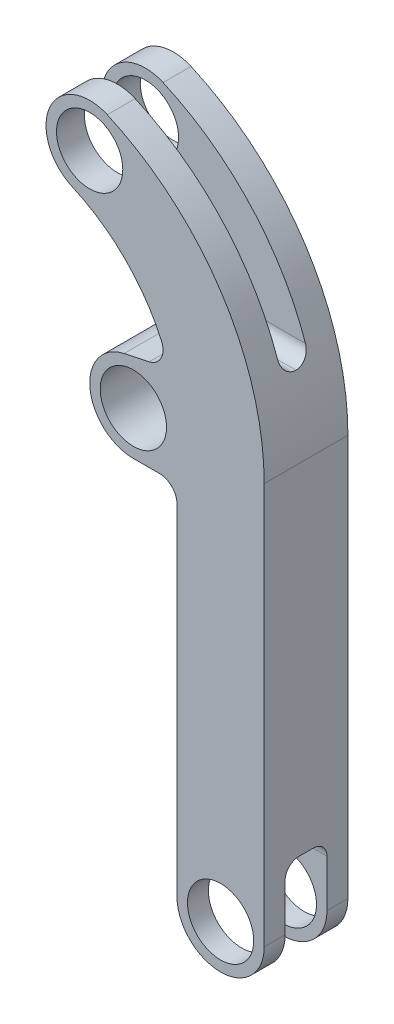
from build123d import *

# Parameters (mm, degrees)
CROQUIS2_R                 = 12.5
CROQUIS2_R_2               = 9.5
SALIENTE_EXTRUIR1_DEPTH    = 24
CORTAR_EXTRUIR3_DEPTH      = 191.437747955
CORTAR_EXTRUIR3_DEPTH_BACK = 191.437747955
CROQUIS5_W                 = 8
CROQUIS5_H                 = 49.434743854
CORTAR_EXTRUIR4_DEPTH      = 191.437747955
CORTAR_EXTRUIR4_DEPTH_BACK = 191.437747955
CROQUIS6_W                 = 12
CROQUIS6_H                 = 30
CORTAR_EXTRUIR5_DEPTH      = 159.265939688
CORTAR_EXTRUIR5_DEPTH_BACK = 159.265939688
CROQUIS7_W                 = 14.533349016
CROQUIS7_H                 = 8
REDONDEO1_R                = 4


with BuildPart() as part:
    # Croquis2 → Saliente-Extruir1 (new body)
    # profile 1 of 4: a face of its own
    with BuildSketch(Plane.XY):
        with Locations((-37.533349016, 172.653405471)):
            Circle(CROQUIS2_R)
        with Locations((-37.533349016, 172.653405471)):
            Circle(CROQUIS2_R_2, mode=Mode.SUBTRACT)
    # profile 2 of 4: a face of its own
    with BuildSketch(Plane.XY):
        with BuildLine():
            Line((-12.5, 58.855421297), (-12.5, 0))
            ThreePointArc((-12.5, 0), (0, 12.5), (12.5, 0))
            Line((12.5, 0), (12.5, 115))
            ThreePointArc((12.5, 115), (0.265693313, 156.217157525), (-32.475079629, 184.08423706))
            ThreePointArc((-32.475079629, 184.08423706), (-27.057701844, 179.473289366), (-25.033349016, 172.653405471))
            ThreePointArc((-25.033349016, 172.653405471), (-30.713465121, 162.1777583), (-42.591618403, 161.222573883))
            ThreePointArc((-42.591618403, 161.222573883), (-27.406897086, 150.843693068), (-16.941222141, 135.718661617))
            ThreePointArc((-16.941222141, 135.718661617), (-17.037727548, 131.417260647), (-20.439743892, 128.783319041))
            Line((-20.439743892, 128.783319041), (-27.655370554, 127.214704549))
            ThreePointArc((-27.655370554, 127.214704549), (-17.155961879, 124.732474812), (-12.5, 115))
            ThreePointArc((-12.5, 115), (-16.161165235, 106.161165235), (-25, 102.5))
            Line((-25, 102.5), (-17.5, 102.5))
            ThreePointArc((-17.5, 102.5), (-13.964466094, 101.035533906), (-12.5, 97.5))
            Line((-12.5, 97.5), (-12.5, 58.855421297))
        make_face()
    # profile 3 of 4: a face of its own
    with BuildSketch(Plane.XY):
        with Locations((-25, 115)):
            Circle(CROQUIS2_R)
        with Locations((-25, 115)):
            Circle(CROQUIS2_R_2, mode=Mode.SUBTRACT)
    # profile 4 of 4: a face of its own
    with BuildSketch(Plane.XY):
        Circle(CROQUIS2_R)
        Circle(CROQUIS2_R_2, mode=Mode.SUBTRACT)
    extrude(amount=SALIENTE_EXTRUIR1_DEPTH)

    # Croquis5 → Cortar-Extruir3 (cut, two sides: drawn at the far end of the back side and taken through both)
    with BuildSketch(Plane.ZY.offset(12.5).offset(-CORTAR_EXTRUIR3_DEPTH_BACK)):
        with Locations((12, 160.436033544)):
            Rectangle(CROQUIS5_W, CROQUIS5_H)
    extrude(amount=CORTAR_EXTRUIR3_DEPTH + CORTAR_EXTRUIR3_DEPTH_BACK, mode=Mode.SUBTRACT)

    # Croquis6 → Cortar-Extruir4 (cut, two sides: drawn at the far end of the back side and taken through both)
    with BuildSketch(Plane.ZY.offset(12.5).offset(-CORTAR_EXTRUIR4_DEPTH_BACK)):
        with Locations((12, 2.5)):
            Rectangle(CROQUIS6_W, CROQUIS6_H)
    extrude(amount=CORTAR_EXTRUIR4_DEPTH + CORTAR_EXTRUIR4_DEPTH_BACK, mode=Mode.SUBTRACT)

    # Croquis7 → Cortar-Extruir5 (cut, two sides: drawn at the far end of the back side and taken through both)
    with BuildSketch(Plane(origin=(0, 135.718661617, 0), x_dir=(1, 0, 0), z_dir=(0, 1, 0)).offset(-CORTAR_EXTRUIR5_DEPTH_BACK)):
        with Locations((-42.766674508, -12)):
            Rectangle(CROQUIS7_W, CROQUIS7_H)
    extrude(amount=CORTAR_EXTRUIR5_DEPTH + CORTAR_EXTRUIR5_DEPTH_BACK, mode=Mode.SUBTRACT)

    # Redondeo1
    # the kernel refuses this fillet: 4 mm, written as the material it adds along each edge
    with BuildSketch(Plane(origin=(-26.941222141, 135.718661617, 16), x_dir=(0, 1, 0), z_dir=(1, 0, 0))) as redondeo1_piece_1_section:
        with BuildLine():
            CenterArc((REDONDEO1_R, -REDONDEO1_R), REDONDEO1_R, 90, 90)
            Line((0, -REDONDEO1_R), (-REDONDEO1_R * 0.02, -REDONDEO1_R))
            Line((-REDONDEO1_R * 0.02, -REDONDEO1_R), (-REDONDEO1_R * 0.02, REDONDEO1_R * 0.02))
            Line((-REDONDEO1_R * 0.02, REDONDEO1_R * 0.02), (REDONDEO1_R, REDONDEO1_R * 0.02))
            Line((REDONDEO1_R, REDONDEO1_R * 0.02), (REDONDEO1_R, 0))
        make_face()
    redondeo1_piece_1 = extrude(amount=46.544739715, mode=Mode.PRIVATE)
    redondeo1_piece_1 = redondeo1_piece_1 & Plane(origin=(-63.045397247, 115.0005, 15.097345218), x_dir=(0.9999999999780976, -6.618536910383344e-06, 0), z_dir=(0, 0, -1)) * Cylinder(75.545397249, 110, mode=Mode.PRIVATE)
    redondeo1_piece_1 = redondeo1_piece_1 - Plane(origin=(-63.045397247, 115.0005, 15.097345218), x_dir=(0.40466155096197987, 0.9144665270927335, 0), z_dir=(0, 0, -1)) * Cylinder(50.545397249, 110, mode=Mode.PRIVATE)
    add(redondeo1_piece_1)
    with BuildSketch(Plane(origin=(19.603517574, 135.718661617, 8), x_dir=(0, 0, 1), z_dir=(-1, 0, 0))) as redondeo1_piece_2_section:
        with BuildLine():
            CenterArc((REDONDEO1_R, REDONDEO1_R), REDONDEO1_R, 180, 90)
            Line((0, REDONDEO1_R), (-REDONDEO1_R * 0.02, REDONDEO1_R))
            Line((-REDONDEO1_R * 0.02, REDONDEO1_R), (-REDONDEO1_R * 0.02, -REDONDEO1_R * 0.02))
            Line((-REDONDEO1_R * 0.02, -REDONDEO1_R * 0.02), (REDONDEO1_R, -REDONDEO1_R * 0.02))
            Line((REDONDEO1_R, -REDONDEO1_R * 0.02), (REDONDEO1_R, 0))
        make_face()
    redondeo1_piece_2 = extrude(amount=46.544739715, mode=Mode.PRIVATE)
    redondeo1_piece_2 = redondeo1_piece_2 - Plane(origin=(-63.045397247, 115.0005, 8.902651886), x_dir=(0.40466155096197987, 0.9144665270927335, 0), z_dir=(0, 0, -1)) * Cylinder(50.545397249, 110, mode=Mode.PRIVATE)
    redondeo1_piece_2 = redondeo1_piece_2 & Plane(origin=(-63.045397247, 115.0005, 8.902651886), x_dir=(0.9999999999780976, -6.618536910383344e-06, 0), z_dir=(0, 0, -1)) * Cylinder(75.545397249, 110, mode=Mode.PRIVATE)
    add(redondeo1_piece_2)
    with BuildSketch(Plane(origin=(-12.5, 17.5, 6), x_dir=(0, 0, 1), z_dir=(1, 0, 0))) as redondeo1_piece_3:
        with BuildLine():
            CenterArc((REDONDEO1_R, REDONDEO1_R), REDONDEO1_R, 180, 90)
            Line((0, REDONDEO1_R), (-REDONDEO1_R * 0.02, REDONDEO1_R))
            Line((-REDONDEO1_R * 0.02, REDONDEO1_R), (-REDONDEO1_R * 0.02, -REDONDEO1_R * 0.02))
            Line((-REDONDEO1_R * 0.02, -REDONDEO1_R * 0.02), (REDONDEO1_R, -REDONDEO1_R * 0.02))
            Line((REDONDEO1_R, -REDONDEO1_R * 0.02), (REDONDEO1_R, 0))
        make_face()
    extrude(amount=25)
    with BuildSketch(Plane(origin=(12.5, 17.5, 18), x_dir=(0, -1, 0), z_dir=(-1, 0, 0))) as redondeo1_piece_4:
        with BuildLine():
            CenterArc((REDONDEO1_R, -REDONDEO1_R), REDONDEO1_R, 90, 90)
            Line((0, -REDONDEO1_R), (-REDONDEO1_R * 0.02, -REDONDEO1_R))
            Line((-REDONDEO1_R * 0.02, -REDONDEO1_R), (-REDONDEO1_R * 0.02, REDONDEO1_R * 0.02))
            Line((-REDONDEO1_R * 0.02, REDONDEO1_R * 0.02), (REDONDEO1_R, REDONDEO1_R * 0.02))
            Line((REDONDEO1_R, REDONDEO1_R * 0.02), (REDONDEO1_R, 0))
        make_face()
    extrude(amount=25)


solid = part.part
